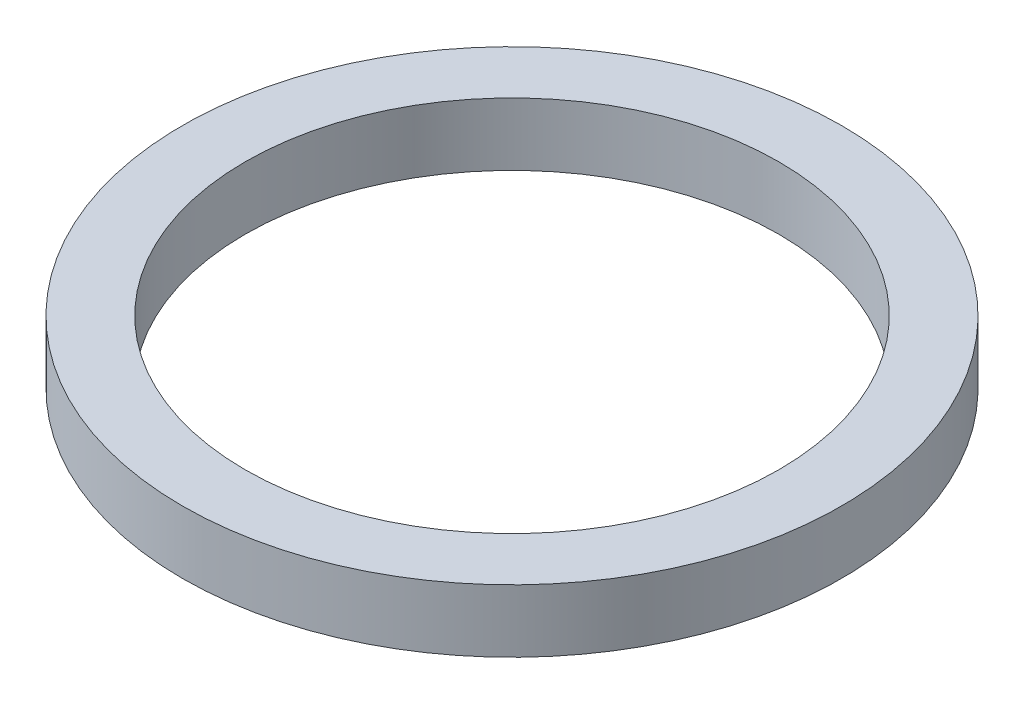
from build123d import *

# Parameters (mm, degrees)
SKETCH1_R           = 52.5
BOSS_EXTRUDE1_DEPTH = 10
SKETCH2_R           = 42.5
CUT_EXTRUDE1_DEPTH  = 75.916620319


with BuildPart() as part:
    # Sketch1 → Boss-Extrude1 (new body)
    with BuildSketch(Plane(origin=(0, 0, 0), x_dir=(1, 0, 0), z_dir=(0, 1, 0))):
        Circle(SKETCH1_R)
    extrude(amount=BOSS_EXTRUDE1_DEPTH)

    # Sketch2 → Cut-Extrude1 (cut, through all)
    with BuildSketch(Plane(origin=(0, 0, 0), x_dir=(1, 0, 0), z_dir=(0, 1, 0))):
        Circle(SKETCH2_R)
    extrude(amount=CUT_EXTRUDE1_DEPTH, mode=Mode.SUBTRACT)


solid = part.part
